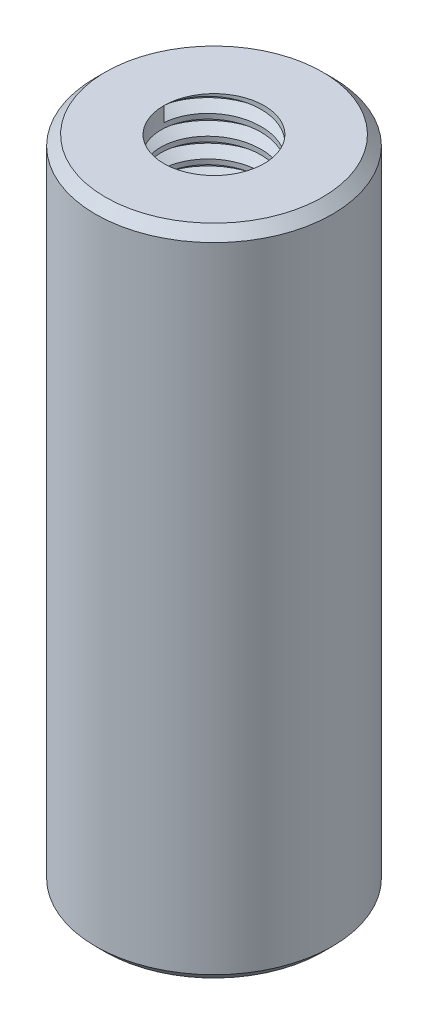
from build123d import *
from build123d.topology import SkipClean

# Parameters (mm, degrees)
CROQUIS2_R              = 4.7625
SALIENTE_EXTRUIR1_DEPTH = 13.15085
CHAFL_N1_SIZE           = 0.396875
TAP_START               = 13.15085
CROQUIS3_R              = 2.0193
TAP_HOLE_1_DEPTH        = 9.525
TAP_START_2             = -3.62585
CROQUIS3_2_R            = 2.0193
TAP_HOLE_2_DEPTH        = 9.525
ROSCA1_PITCH            = 0.79375
ROSCA2_PITCH            = 0.79375


with BuildPart() as part:
    # Croquis2 → Saliente-Extruir1 (new, symmetric)
    with BuildSketch(Plane(origin=(0, 0, 0), x_dir=(1, 0, 0), z_dir=(0, 1, 0))):
        with Locations(Location((0, 0, 0), (0, 0, 270))):
            Circle(CROQUIS2_R)
    extrude(amount=SALIENTE_EXTRUIR1_DEPTH, both=True)

    # Chaflán1
    chafl_n1_edges = [part.edges().sort_by_distance(p)[0] for p in [
        (0, -13.15085, -4.7625),
        (0, 13.15085, -4.7625),
    ]]
    chamfer(chafl_n1_edges, length=CHAFL_N1_SIZE)

    # Croquis3 → Tap Hole 1 (cut)
    with BuildSketch(Plane(origin=(0, 0, 0), x_dir=(1, 0, 0), z_dir=(0, 1, 0)).offset(TAP_START)):
        with Locations(Location((0, 0, 0), (0, 0, 270))):
            Circle(CROQUIS3_R)
    extrude(amount=-TAP_HOLE_1_DEPTH, mode=Mode.SUBTRACT)

    # Croquis3<2> → Tap Hole 2 (cut)
    with BuildSketch(Plane(origin=(0, 0, 0), x_dir=(1, 0, 0), z_dir=(0, 1, 0)).offset(TAP_START_2)):
        with Locations(Location((0, 0, 0), (0, 0, 270))):
            Circle(CROQUIS3_2_R)
    extrude(amount=-TAP_HOLE_2_DEPTH, mode=Mode.SUBTRACT)

    # Rosca1: the profile of Perfil de rosca1 profile screwed along a right-hand helix of 12 turns, 8 arcs to a turn; built about Z, then put on its axis
    with SkipClean():  # the faces are left unmerged after this step: merging them gives an invalid solid
        rosca1_z = Axis((0, 0, 0), (0, 0, 1))
        rosca1_corners = [(2.019, 0, -0.000173205), (2.448929788, 0, 0.248046874), (2.448929788, 0, 0.347265624), (2.019, 0, 0.595485703)]
        with BuildLine(mode=Mode.PRIVATE) as rosca1_profile:
            Line(rosca1_corners[0], rosca1_corners[1])
            Line(rosca1_corners[1], rosca1_corners[2])
            Line(rosca1_corners[2], rosca1_corners[3])
            Line(rosca1_corners[3], rosca1_corners[0])
        rosca1_cap = Face(rosca1_profile.wire())
        rosca1_turn_angles = [0, 22.5, 45, 67.5, 90, 112.5, 135, 157.5, 180, 202.5, 225, 247.5, 270, 292.5, 315, 337.5, 360]
        rosca1_turn_weights = [1, 0.9238795325112867, 1, 0.9238795325112867, 1, 0.9238795325112867, 1, 0.9238795325112867, 1, 0.9238795325112867, 1, 0.9238795325112867, 1, 0.9238795325112867, 1, 0.9238795325112867, 1]
        rosca1_turn_rails = [Edge.make_bspline([Vector(p[0], p[1], 0).rotate(rosca1_z, rosca1_turn_angles[k]) / rosca1_turn_weights[k] + Vector(0, 0, p[2] + ROSCA1_PITCH * rosca1_turn_angles[k] / 360) for k in range(17)], [0, 0, 0, 1, 1, 2, 2, 3, 3, 4, 4, 5, 5, 6, 6, 7, 7, 8, 8, 8], 2, rosca1_turn_weights) for p in rosca1_corners]
        rosca1_turn_sides = [Face.make_surface_from_curves(rosca1_turn_rails[p[0]], rosca1_turn_rails[p[1]]) for p in [(0, 1), (1, 2), (2, 3), (3, 0)]]
        rosca1 = Plane(origin=(0, 13.15085, 0), x_dir=(-1, 0, 0), z_dir=(0, -1, 0)) * Solid(Shell([*[p.moved(Location((0, 0, ROSCA1_PITCH * i))) for i in range(12) for p in rosca1_turn_sides], rosca1_cap, rosca1_cap.rotate(rosca1_z, 4320).moved(Location((0, 0, ROSCA1_PITCH * 4320 / 360)))]))
        add(rosca1, mode=Mode.SUBTRACT)

    # Rosca2: the profile of Perfil de rosca2 profile screwed along a right-hand helix of 12 turns, 8 arcs to a turn; built about Z, then put on its axis
    with SkipClean():  # the faces are left unmerged after this step: merging them gives an invalid solid
        rosca2_z = Axis((0, 0, 0), (0, 0, 1))
        rosca2_corners = [(2.019, 0, -0.000173205), (2.448929788, 0, 0.248046874), (2.448929788, 0, 0.347265624), (2.019, 0, 0.595485703)]
        with BuildLine(mode=Mode.PRIVATE) as rosca2_profile:
            Line(rosca2_corners[0], rosca2_corners[1])
            Line(rosca2_corners[1], rosca2_corners[2])
            Line(rosca2_corners[2], rosca2_corners[3])
            Line(rosca2_corners[3], rosca2_corners[0])
        rosca2_cap = Face(rosca2_profile.wire())
        rosca2_turn_angles = [0, 22.5, 45, 67.5, 90, 112.5, 135, 157.5, 180, 202.5, 225, 247.5, 270, 292.5, 315, 337.5, 360]
        rosca2_turn_weights = [1, 0.9238795325112867, 1, 0.9238795325112867, 1, 0.9238795325112867, 1, 0.9238795325112867, 1, 0.9238795325112867, 1, 0.9238795325112867, 1, 0.9238795325112867, 1, 0.9238795325112867, 1]
        rosca2_turn_rails = [Edge.make_bspline([Vector(p[0], p[1], 0).rotate(rosca2_z, rosca2_turn_angles[k]) / rosca2_turn_weights[k] + Vector(0, 0, p[2] + ROSCA2_PITCH * rosca2_turn_angles[k] / 360) for k in range(17)], [0, 0, 0, 1, 1, 2, 2, 3, 3, 4, 4, 5, 5, 6, 6, 7, 7, 8, 8, 8], 2, rosca2_turn_weights) for p in rosca2_corners]
        rosca2_turn_sides = [Face.make_surface_from_curves(rosca2_turn_rails[p[0]], rosca2_turn_rails[p[1]]) for p in [(0, 1), (1, 2), (2, 3), (3, 0)]]
        rosca2 = Plane(origin=(0, -13.15085, 0), x_dir=(1, 0, 0), z_dir=(0, 1, 0)) * Solid(Shell([*[p.moved(Location((0, 0, ROSCA2_PITCH * i))) for i in range(12) for p in rosca2_turn_sides], rosca2_cap, rosca2_cap.rotate(rosca2_z, 4320).moved(Location((0, 0, ROSCA2_PITCH * 4320 / 360)))]))
        add(rosca2, mode=Mode.SUBTRACT)


solid = part.part
